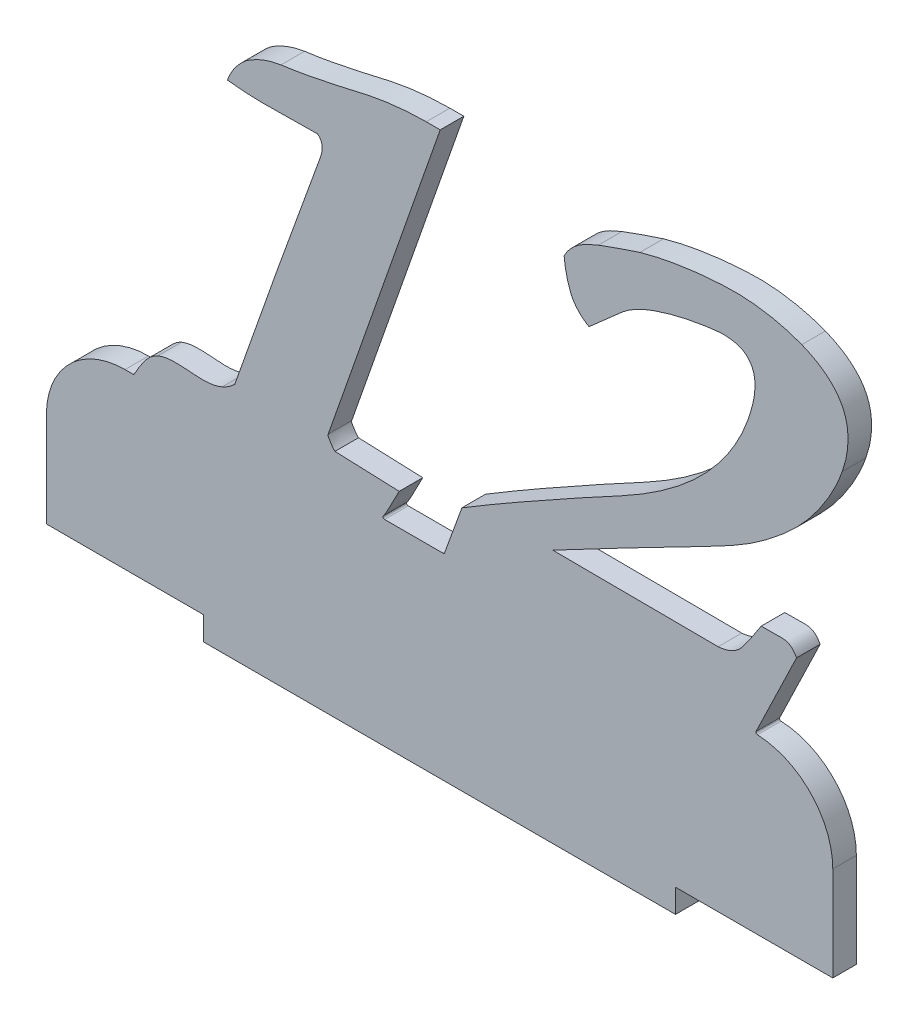
from build123d import *

# Parameters (mm, degrees)
BOSS_EXTRUDE1_DEPTH = 3
FILLET1_R           = 10
FILLET2_R           = 0.2


with BuildPart() as part:
    # Sketch1 → Boss-Extrude1 (new body)
    with BuildSketch(Plane.XY):
        with BuildLine():
            Line((42.537984076, 22.000000982), (50.584636746, 22.000000982))
            Line((50.584636746, 22.000000982), (52.839649235, 28.197109379))
            add(Edge.make_bspline(
                [(52.839649235, 28.197109379), (54.248714684, 29.045506519), (56.431909075, 30.357383962), (59.474309712, 32.090120544), (61.944850647, 33.524828625), (64.570783761, 34.985747142), (67.336324518, 36.511397195), (70.231324588, 38.121508187), (73.255007633, 39.710376785), (76.200009812, 41.39768715), (78.906567156, 43.225136503), (81.348027085, 45.112569426), (83.490641674, 47.118195151), (85.357416855, 49.206298383), (87.428198995, 52.081305478), (88.630794744, 54.409507668), (89.196177773, 56.031354884)],
                knots=[0, 0, 0, 0, 0.105524725, 0.163385995, 0.224617296, 0.288806203, 0.356161699, 0.427252852, 0.501313646, 0.575301268, 0.644861957, 0.710669145, 0.773069231, 0.832880115, 0.890073183, 1, 1, 1, 1], degree=3))
            add(Edge.make_bspline(
                [(89.196177773, 56.031354884), (89.625842409, 57.266839405), (90.155099381, 59.015505319), (90.105779781, 61.237355295), (89.66646939, 62.439251642), (88.84893126, 63.338971158), (87.635580146, 63.810940124), (86.136489342, 63.992093331), (84.396326749, 63.803607869), (82.578344606, 63.493806461), (80.812926713, 63.154877277), (79.204447684, 62.73821432), (77.736657379, 62.289804925), (76.402583676, 61.814244169), (74.896898698, 61.102776297), (73.866127773, 60.496052109), (73.285309908, 59.99929859)],
                knots=[0, 0, 0, 0, 0.163533838, 0.22358703, 0.273097817, 0.319542769, 0.369979931, 0.431293779, 0.506061157, 0.586526579, 0.660902098, 0.729494961, 0.793064576, 0.851774175, 0.90542867, 1, 1, 1, 1], degree=3))
            Line((73.285309908, 59.99929859), (69.00462187, 56.226820091))
            add(Edge.make_bspline(
                [(69.00462187, 56.226820091), (68.473738468, 56.526672064), (67.547969563, 57.251968605), (66.901989109, 58.235224326), (66.698132425, 58.748321264)],
                knots=[0, 0, 0, 0, 0.525688222, 1, 1, 1, 1], degree=3))
            add(Edge.make_bspline(
                [(66.698132425, 58.748321264), (65.989020109, 60.529360233), (65.838085514, 62.44261368)],
                knots=[0, 0, 0, 1, 1, 1], degree=2))
            add(Edge.make_bspline(
                [(65.838085514, 62.44261368), (66.216607319, 63.204516033), (67.48287064, 64.66140426), (69.248688382, 65.425296692), (70.196959634, 65.804615243)],
                knots=[0, 0, 0, 0, 0.451020123, 1, 1, 1, 1], degree=3))
            add(Edge.make_bspline(
                [(70.196959634, 65.804615243), (72.817005486, 66.776950367), (75.474520228, 67.641988191)],
                knots=[0, 0, 0, 1, 1, 1], degree=2))
            add(Edge.make_bspline(
                [(75.474520228, 67.641988191), (77.097723123, 68.109547469), (79.616741412, 68.628507184), (83.063826554, 69.097528685), (85.75140454, 69.30616535), (88.452721605, 69.381691523), (91.938548042, 69.027238786), (94.465489273, 68.405808951), (96.057006546, 67.778813836)],
                knots=[0, 0, 0, 0, 0.242040332, 0.368376016, 0.498665213, 0.628561786, 0.755290793, 1, 1, 1, 1], degree=3))
            add(Edge.make_bspline(
                [(96.057006546, 67.778813836), (97.234318545, 67.300298489), (98.882536444, 66.423932293), (100.544073343, 64.729705469), (101.396826889, 63.351216745), (101.868398713, 61.797519742), (102.045609891, 59.41443702), (101.629471012, 57.577060636), (101.197741495, 56.363645736)],
                knots=[0, 0, 0, 0, 0.269969076, 0.3868787, 0.498157891, 0.609266408, 0.726758964, 1, 1, 1, 1], degree=3))
            add(Edge.make_bspline(
                [(101.197741495, 56.363645736), (100.627905221, 54.705185204), (99.401800162, 52.344246797), (97.33010629, 49.432482993), (95.47843029, 47.345736731), (93.329490859, 45.400929794), (90.938970266, 43.534651518), (88.270428499, 41.790403458), (84.397423166, 39.705285051), (79.587729815, 37.28204241), (72.604067537, 33.62463429), (67.574334477, 31.023637696), (64.39164298, 29.31126106)],
                knots=[0, 0, 0, 0, 0.112095574, 0.169586155, 0.228763596, 0.290550216, 0.355136688, 0.423026188, 0.494632822, 0.636984017, 0.768320184, 1, 1, 1, 1], degree=3))
            Line((64.39164298, 29.31126106), (85.423699274, 29.193981936))
            add(Edge.make_bspline(
                [(85.423699274, 29.193981936), (86.082600666, 29.252133566), (87.056534892, 29.476510222), (88.110965689, 30.221368973), (89.344492612, 31.708414679), (90.132287268, 33.128468355), (90.896725076, 34.19789124)],
                knots=[0, 0, 0, 0, 0.257232278, 0.374596102, 0.492310467, 1, 1, 1, 1], degree=3))
            add(Edge.make_bspline(
                [(90.896725076, 34.19789124), (91.748722118, 34.159580523), (92.786549209, 34.246487699), (94.041100815, 34.199570399), (94.810812918, 33.848834983), (95.196520755, 33.322492941), (95.392424841, 32.946913914)],
                knots=[0, 0, 0, 0, 0.506825366, 0.628241153, 0.743426283, 1, 1, 1, 1], degree=3))
            Line((95.392424841, 32.946913914), (90.110220598, 22.000000982))
            Line((90.110220598, 22.000000982), (100, 22.000000982))
            Line((100, 22.000000982), (100, 0))
            Line((100, 0), (80, 0))
            Line((80, 0), (80, -3))
            Line((80, -3), (20, -3))
            Line((20, -3), (20, 0))
            Line((20, 0), (0, 0))
            Line((0, 0), (0, 22.000000982))
            Line((0, 22.000000982), (11.126314779, 22.000000982))
            add(Edge.make_bspline(
                [(11.126314779, 22.000000982), (11.179175101, 22.091287797), (11.479303034, 22.615987108), (12.260783592, 24.017880313), (13.255402926, 25.187491124), (14.196177773, 25.616968644)],
                knots=[0.196060683, 0.196060683, 0.196060683, 0.196060683, 0.24891213, 0.498932816, 1, 1, 1, 1], degree=3))
            add(Edge.make_bspline(
                [(14.196177773, 25.616968644), (15.537546067, 26.136232655), (18.288283832, 25.861464595), (21.057617255, 25.705816495), (22.366623434, 26.281550349)],
                knots=[0, 0, 0, 0, 0.501451854, 1, 1, 1, 1], degree=3))
            add(Edge.make_bspline(
                [(22.366623434, 26.281550349), (23.248166371, 26.672062902), (23.949891612, 27.337062468)],
                knots=[0, 0, 0, 1, 1, 1], degree=2))
            add(Edge.make_bspline(
                [(23.949891612, 27.337062468), (25.732187491, 32.372235468), (29.257184693, 42.495036723), (32.946212686, 52.559233475), (34.778664091, 57.614623062)],
                knots=[0, 0, 0, 0, 0.498322561, 1, 1, 1, 1], degree=3))
            add(Edge.make_bspline(
                [(34.778664091, 57.614623062), (34.961841156, 58.112161275), (35.257027284, 59.078737049), (34.804433512, 59.990132521), (34.446373238, 60.194763797)],
                knots=[0, 0, 0, 0, 0.581397084, 1, 1, 1, 1], degree=3))
            add(Edge.make_bspline(
                [(34.446373238, 60.194763797), (32.529652356, 60.228560869), (28.724661476, 60.044652466), (24.911679757, 60.149389343), (23.031205138, 60.390229004)],
                knots=[0, 0, 0, 0, 0.503014916, 1, 1, 1, 1], degree=3))
            add(Edge.make_bspline(
                [(23.031205138, 60.390229004), (23.263167648, 61.057401499), (23.747411258, 62.006355534), (24.665405373, 63.067091706), (25.438689115, 63.789616743), (26.386650807, 64.343325333), (27.813668818, 65.026024955), (29.005726498, 65.340841829), (29.833394349, 65.472324391)],
                knots=[0, 0, 0, 0, 0.237267367, 0.352023708, 0.469658656, 0.590380818, 0.718477308, 1, 1, 1, 1], degree=3))
            add(Edge.make_bspline(
                [(29.833394349, 65.472324391), (32.945660374, 65.870761534), (36.807427968, 66.722765492), (41.429227523, 67.802579697), (44.509128617, 68.285055442), (46.80221991, 68.432605881), (48.304856428, 68.44339554)],
                knots=[0, 0, 0, 0, 0.501477793, 0.632810111, 0.759518477, 1, 1, 1, 1], degree=3))
            add(Edge.make_bspline(
                [(48.304856428, 68.44339554), (48.513352649, 68.44339554), (49.106263778, 68.44339554), (49.699174906, 68.44339554), (50.083589814, 68.44339554)],
                knots=[0, 0, 0, 0, 0.351648352, 1, 1, 1, 1], degree=3))
            Line((50.083589814, 68.44339554), (35.834176209, 27.806178965))
            add(Edge.make_bspline(
                [(35.834176209, 27.806178965), (35.780993555, 27.60638247), (36.11263329, 27.096689411), (36.390323638, 26.613906537), (36.694223121, 26.340189911)],
                knots=[0, 0, 0, 0, 0.324502414, 1, 1, 1, 1], degree=3))
            Line((36.694223121, 26.340189911), (44.864668782, 26.02744558))
            add(Edge.make_bspline(
                [(44.864668782, 26.02744558), (44.269729217, 25.014226453), (43.724569108, 23.691987076), (42.904365523, 22.352776547), (42.628440441, 22.079744483), (42.537984076, 22.000000982)],
                knots=[0, 0, 0, 0, 0.504343167, 0.619768133, 0.671675172, 0.671675172, 0.671675172, 0.671675172], degree=3))
        make_face()
    extrude(amount=BOSS_EXTRUDE1_DEPTH)

    # Fillet1
    # the kernel refuses this fillet: 10 mm, written as the material it takes off along each edge
    with BuildSketch(Plane(origin=(100, 22.000000982, -25), x_dir=(-1, 0, 0), z_dir=(0, 0, 1))) as fillet1_piece_1_section:
        with BuildLine():
            CenterArc((FILLET1_R, FILLET1_R), FILLET1_R, 180, 90)
            Line((0, FILLET1_R), (0, 0))
            Line((0, 0), (FILLET1_R, 0))
        make_face()
    fillet1_piece_1 = extrude(amount=53, mode=Mode.PRIVATE)
    fillet1_piece_1 = split(fillet1_piece_1, bisect_by=Plane(origin=(90.664979053, 23.149690057, 1.5), z_dir=(0.9006325457122767, -0.4345814280475224, 0)), keep=Keep.TOP, mode=Mode.PRIVATE)
    add(fillet1_piece_1, mode=Mode.SUBTRACT)
    with BuildSketch(Plane(origin=(0, 22.000000982, -25), x_dir=(0, -1, 0), z_dir=(0, 0, 1))) as fillet1_piece_2:
        with BuildLine():
            CenterArc((FILLET1_R, FILLET1_R), FILLET1_R, 180, 90)
            Line((0, FILLET1_R), (0, 0))
            Line((0, 0), (FILLET1_R, 0))
        make_face()
    extrude(amount=53, mode=Mode.SUBTRACT)

    # Fillet2
    fillet2_edges = [part.edges().sort_by_distance(p)[0] for p in [
        (90.109929036, 21.999396745, 1.5),
        (42.537984076, 22.000000982, 1.5),
        (50.584636746, 22.000000982, 1.5),
        (11.126314779, 22.000000982, 1.5),
    ]]
    fillet(fillet2_edges, radius=FILLET2_R)


solid = part.part
